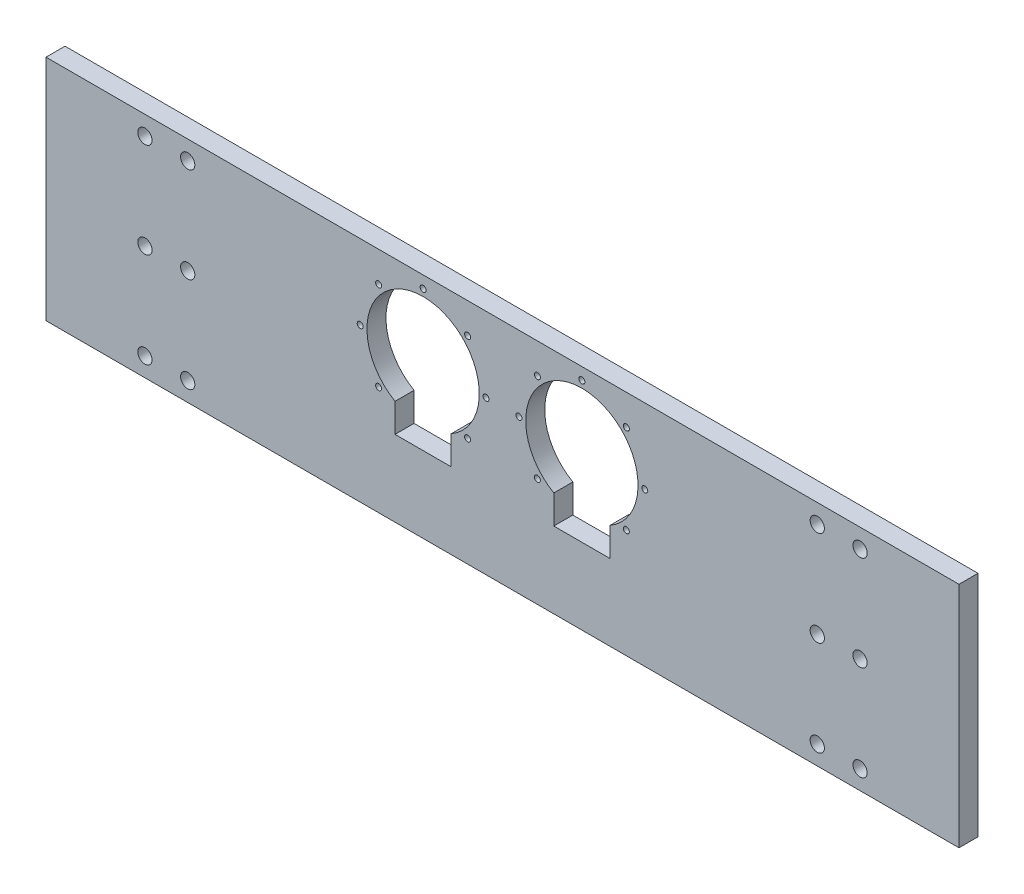
from build123d import *

# Parameters (mm, degrees)
SKETCH1_W           = 609.6
SKETCH1_H           = 152.4
SKETCH1_R           = 1.999996
SKETCH1_R_2         = 4.7625
BOSS_EXTRUDE1_DEPTH = 12.7


with BuildPart() as part:
    # Sketch1 → Boss-Extrude1 (new body)
    with BuildSketch(Plane.XY):
        Rectangle(SKETCH1_W, SKETCH1_H)
        with Locations((53, 68.2000033)):
            Circle(SKETCH1_R, mode=Mode.SUBTRACT)
        with Locations((82.698488275, 55.898486675)):
            Circle(SKETCH1_R, mode=Mode.SUBTRACT)
        with Locations((95.0000049, 26.1999984)):
            Circle(SKETCH1_R, mode=Mode.SUBTRACT)
        with Locations((82.698488275, -3.498489875)):
            Circle(SKETCH1_R, mode=Mode.SUBTRACT)
        with Locations((23.301511725, -3.498489875)):
            Circle(SKETCH1_R, mode=Mode.SUBTRACT)
        with Locations((10.9999951, 26.1999984)):
            Circle(SKETCH1_R, mode=Mode.SUBTRACT)
        with Locations((23.301511725, 55.898486675)):
            Circle(SKETCH1_R, mode=Mode.SUBTRACT)
        with Locations((238.76, 63.5)):
            Circle(SKETCH1_R_2, mode=Mode.SUBTRACT)
        with Locations((210.185, 63.5)):
            Circle(SKETCH1_R_2, mode=Mode.SUBTRACT)
        with Locations((238.76, -63.5)):
            Circle(SKETCH1_R_2, mode=Mode.SUBTRACT)
        with Locations((210.185, -63.5)):
            Circle(SKETCH1_R_2, mode=Mode.SUBTRACT)
        with Locations((-82.698488275, -3.498489875)):
            Circle(SKETCH1_R, mode=Mode.SUBTRACT)
        with Locations((-95.0000049, 26.1999984)):
            Circle(SKETCH1_R, mode=Mode.SUBTRACT)
        with Locations((-82.698488275, 55.898486675)):
            Circle(SKETCH1_R, mode=Mode.SUBTRACT)
        with Locations((-53, 68.2000033)):
            Circle(SKETCH1_R, mode=Mode.SUBTRACT)
        with Locations((-23.301511725, 55.898486675)):
            Circle(SKETCH1_R, mode=Mode.SUBTRACT)
        with Locations((-10.9999951, 26.1999984)):
            Circle(SKETCH1_R, mode=Mode.SUBTRACT)
        with Locations((-23.301511725, -3.498489875)):
            Circle(SKETCH1_R, mode=Mode.SUBTRACT)
        with Locations((-238.76, 63.5)):
            Circle(SKETCH1_R_2, mode=Mode.SUBTRACT)
        with Locations((-210.185, 63.5)):
            Circle(SKETCH1_R_2, mode=Mode.SUBTRACT)
        with Locations((-210.185, -63.5)):
            Circle(SKETCH1_R_2, mode=Mode.SUBTRACT)
        with Locations((-238.76, -63.5)):
            Circle(SKETCH1_R_2, mode=Mode.SUBTRACT)
        with Locations((210.185, 0)):
            Circle(SKETCH1_R_2, mode=Mode.SUBTRACT)
        with Locations((238.76, 0)):
            Circle(SKETCH1_R_2, mode=Mode.SUBTRACT)
        with Locations((-238.76, 0)):
            Circle(SKETCH1_R_2, mode=Mode.SUBTRACT)
        with Locations((-210.185, 0)):
            Circle(SKETCH1_R_2, mode=Mode.SUBTRACT)
        with BuildLine():
            Line((34.2499994, -6.275955281), (34.2499994, -25.4))
            Line((34.2499994, -25.4), (71.7500006, -25.4))
            Line((71.7500006, -25.4), (71.7500006, -6.275955281))
            ThreePointArc((71.7500006, -6.275955281), (53, 63.6999996), (34.2499994, -6.275955281))
        make_face(mode=Mode.SUBTRACT)
        with BuildLine():
            Line((-34.2499994, -6.275955281), (-34.2499994, -25.4))
            Line((-34.2499994, -25.4), (-71.7500006, -25.4))
            Line((-71.7500006, -25.4), (-71.7500006, -6.275955281))
            ThreePointArc((-71.7500006, -6.275955281), (-53, 63.6999996), (-34.2499994, -6.275955281))
        make_face(mode=Mode.SUBTRACT)
    extrude(amount=BOSS_EXTRUDE1_DEPTH)


solid = part.part
